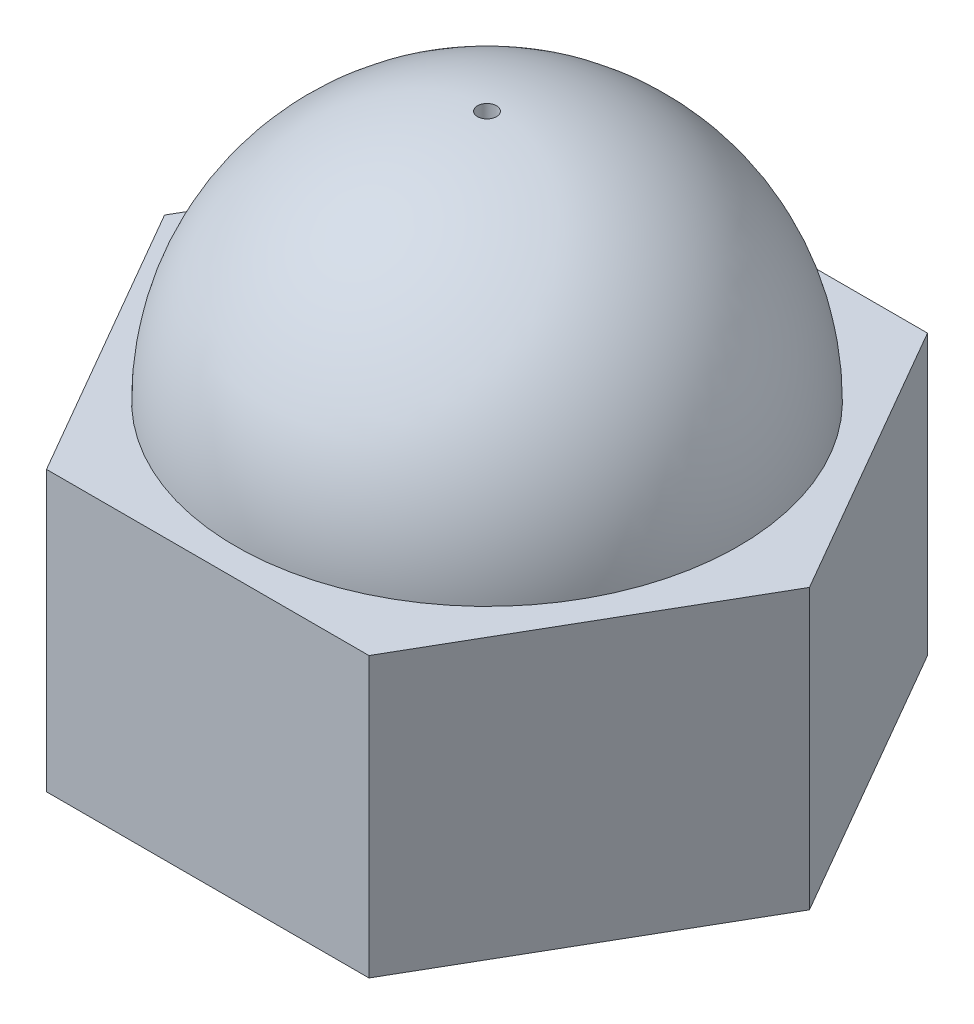
from build123d import *

# Parameters (mm, degrees)
BOSS_EXTRUDE1_DEPTH = 5
SKETCH4_R           = 3
CUT_EXTRUDE1_DEPTH  = 5
SKETCH6_R           = 0.17
CUT_EXTRUDE2_DEPTH  = 10.128709292
CHAMFER2_SIZE       = 0.875
CHAMFER2_SIZE2      = 2


with BuildPart() as part:
    # Sketch1 → Boss-Extrude1 (new body)
    with BuildSketch(Plane(origin=(0, 0, 0), x_dir=(1, 0, 0), z_dir=(0, 1, 0))):
        Polygon((5.773502692, 0), (2.886751346, 5), (-2.886751346, 5), (-5.773502692, 0), (-2.886751346, -5), (2.886751346, -5), align=None)
    extrude(amount=BOSS_EXTRUDE1_DEPTH)

    # Sketch3 → Revolve1 (revolve)
    with BuildSketch(Plane.XY):
        with BuildLine():
            Line((0, 5), (-4.5, 5))
            ThreePointArc((-4.5, 5), (-3.181980515, 8.181980515), (0, 9.5))
            Line((0, 9.5), (0, 5))
        make_face()
    revolve(axis=Axis((0, 0, 0), (0, 1, 0)))

    # Sketch4 → Cut-Extrude1 (cut)
    with BuildSketch(Plane.XZ):
        Circle(SKETCH4_R)
    extrude(amount=-CUT_EXTRUDE1_DEPTH, mode=Mode.SUBTRACT)

    # Sketch6 → Cut-Extrude2 (cut, through all)
    with BuildSketch(Plane.XZ.offset(-5)):
        Circle(SKETCH6_R)
    extrude(amount=-CUT_EXTRUDE2_DEPTH, mode=Mode.SUBTRACT)

    # Chamfer2
    chamfer2_edges = [part.edges().sort_by_distance(p)[0] for p in [
        (-0.17, 5, 0),
    ]]
    chamfer2_side = [part.faces().sort_by_distance(p)[0] for p in [
        (-2.915147186, 5, 0),
    ]]
    chamfer(chamfer2_edges, length=CHAMFER2_SIZE, length2=CHAMFER2_SIZE2, reference=chamfer2_side[0])


solid = part.part
